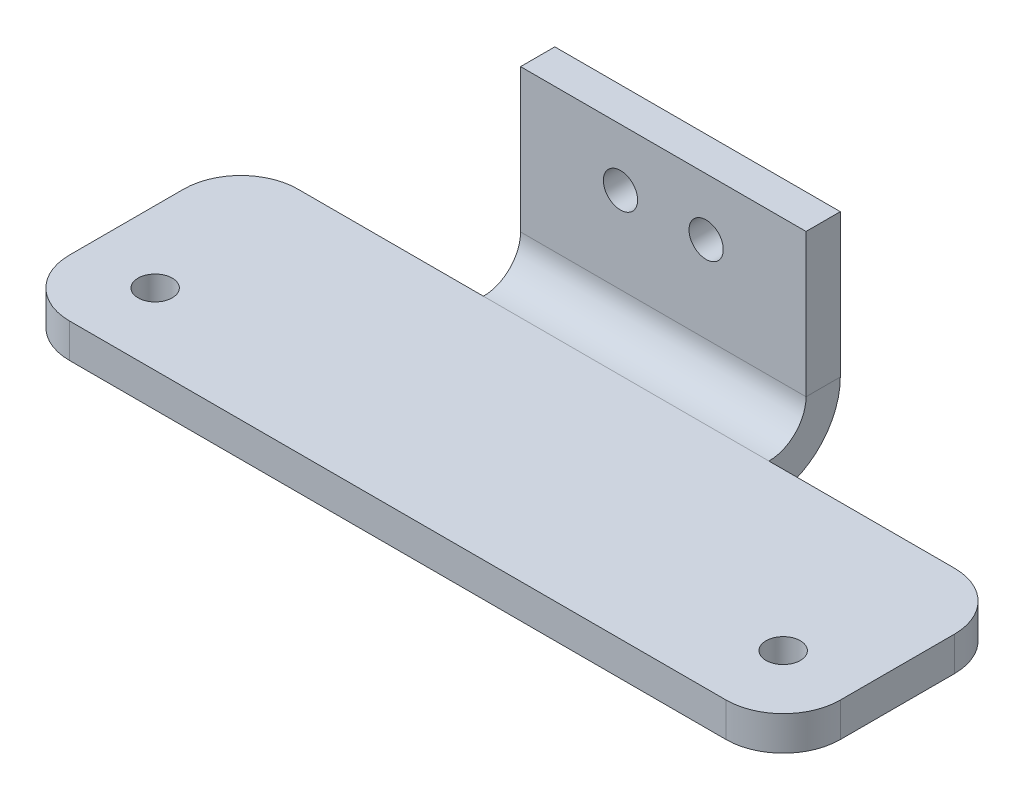
from build123d import *

# Parameters (mm, degrees)
BASE_FLANGE1_DEPTH     = 6
SKETCHED_START         = -25
SKETCHED_BEND1_DEPTH   = 50
SKETCHED_BEND1_2_DEPTH = 50
SKETCH8_R              = 3
CUT_EXTRUDE1_DEPTH     = 82.299658022
SKETCH9_R              = 3
CUT_EXTRUDE2_DEPTH     = 88.83868393
FILLET1_R              = 10


# Read off the part's stored shape, not the designer's step: Sketched Bend1
# Sheet-metal steps are written as plain solids
with BuildPart() as part:
    # Sketch1 → Base-Flange1 (new body)
    with BuildSketch(Plane(origin=(0, 0, 0), x_dir=(1, 0, 0), z_dir=(0, 1, 0))):
        Polygon((25, 20), (67.5, 20), (67.5, -20), (-67.5, -20), (-67.5, 20), (-25, 20), (-25, 60), (25, 60), align=None)
    extrude(amount=-BASE_FLANGE1_DEPTH)

    # Sketched Bend1 outline → Sketched Bend1 (cut)
    with BuildSketch(Plane.YZ.offset(SKETCHED_START)):
        with BuildLine():
            Line((0, -60), (0, -30.677078252))
            ThreePointArc((0, -30.677078252), (-4.397247359, -26.123724357), (-6, -20))
            Line((-6, -20), (-6, -60))
            Line((-6, -60), (0, -60))
        make_face()
    extrude(amount=SKETCHED_BEND1_DEPTH, mode=Mode.SUBTRACT)

    # Sketched Bend1 2 outline → Sketched Bend1 2 (add)
    with BuildSketch(Plane.YZ.offset(SKETCHED_START)):
        with BuildLine():
            Line((6.5, -32.5), (31.577434895, -32.5))
            Line((31.577434895, -32.5), (31.577434895, -26.5))
            Line((31.577434895, -26.5), (6.5, -26.5))
            ThreePointArc((6.5, -26.5), (1.903805922, -24.596194078), (0, -20))
            Line((0, -20), (0, -30.677078252))
            ThreePointArc((0, -30.677078252), (3.124609515, -32.035644523), (6.5, -32.5))
        make_face()
    extrude(amount=SKETCHED_BEND1_2_DEPTH)

    # Sketch8 → Cut-Extrude1 (cut, through all)
    with BuildSketch(Plane(origin=(0, 0, 0), x_dir=(1, 0, 0), z_dir=(0, 1, 0))):
        with Locations(Location((-55, -7.5, 0), (0, 0, 270))):
            Circle(SKETCH8_R)
        with Locations(Location((55, -7.5, 0), (0, 0, 90))):
            Circle(SKETCH8_R)
    extrude(amount=-CUT_EXTRUDE1_DEPTH, mode=Mode.SUBTRACT)

    # Sketch9 → Cut-Extrude2 (cut, through all)
    with BuildSketch(Plane.XY.offset(-26.5)):
        with Locations((-7.5, 21.577434895)):
            Circle(SKETCH9_R)
        with Locations(Location((7.5, 21.577434895, 0), (0, 0, 180))):
            Circle(SKETCH9_R)
    extrude(amount=-CUT_EXTRUDE2_DEPTH, mode=Mode.SUBTRACT)

    # Fillet1
    fillet1_edges = [part.edges().sort_by_distance(p)[0] for p in [
        (-67.5, -3, 20),
        (67.5, -3, 20),
        (67.5, -3, -20),
        (-67.5, -3, -20),
    ]]
    fillet(fillet1_edges, radius=FILLET1_R)


solid = part.part
